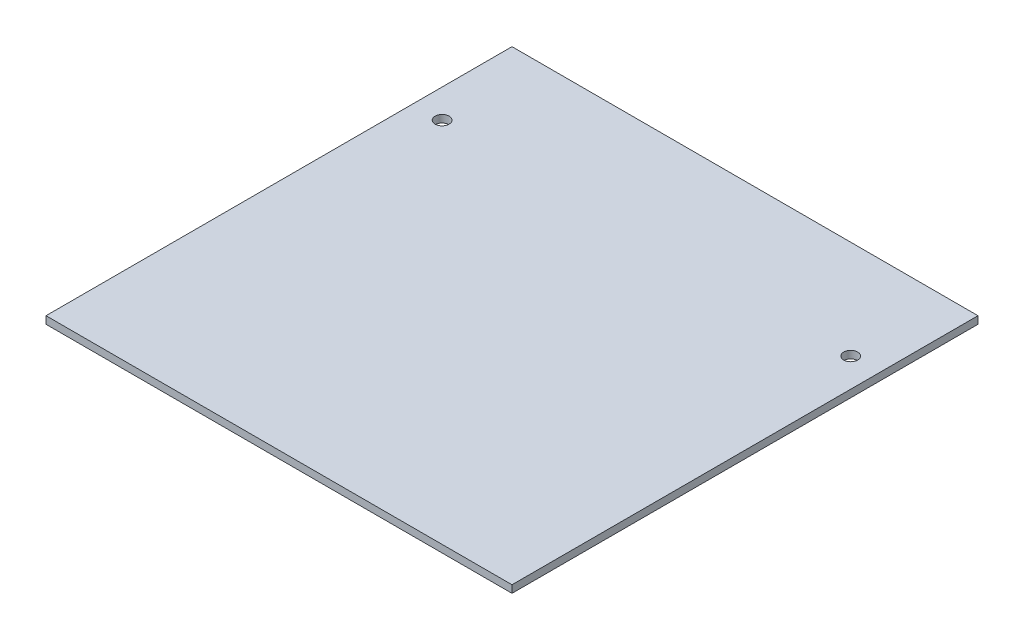
from build123d import *

# Parameters (mm, degrees)
SKETCH1_W           = 50
SKETCH1_H           = 100
SKETCH1_R           = 1.5
BOSS_EXTRUDE1_DEPTH = 1.6


with BuildPart() as part:
    # Sketch1 → Boss-Extrude1 (new body)
    with BuildSketch(Plane(origin=(0, 0, 0), x_dir=(1, 0, 0), z_dir=(0, 1, 0))):
        with Locations((-25, 15)):
            Rectangle(SKETCH1_W, SKETCH1_H)
        with Locations((-43.840620434, 43.840620434)):
            Circle(SKETCH1_R, mode=Mode.SUBTRACT)
    boss_extrude1 = extrude(amount=BOSS_EXTRUDE1_DEPTH)

    # Mirror1: Boss-Extrude1 across plane
    add(boss_extrude1.mirror(Plane(origin=(0, 1.6, 35), x_dir=(0, 0, 1), z_dir=(-1, 0, 0))))


solid = part.part
